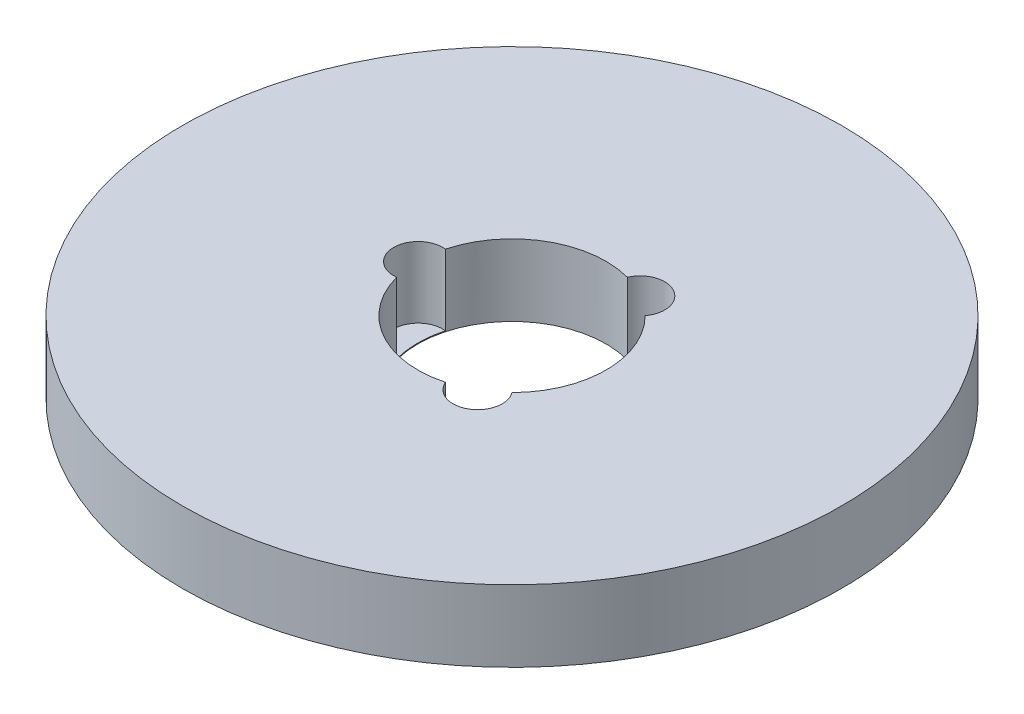
from build123d import *

# Parameters (mm, degrees)
SKETCH1_R           = 87.5
BOSS_EXTRUDE1_DEPTH = 19
SKETCH2_R           = 25
CUT_EXTRUDE1_DEPTH  = 126.193849689
SKETCH3_R           = 6.512696836
CUT_EXTRUDE2_DEPTH  = 18.77068866
CIRPATTERN1_COUNT   = 3


with BuildPart() as part:
    # Sketch1 → Boss-Extrude1 (new body)
    with BuildSketch(Plane(origin=(0, 0, 0), x_dir=(1, 0, 0), z_dir=(0, 1, 0))):
        Circle(SKETCH1_R)
    extrude(amount=BOSS_EXTRUDE1_DEPTH)

    # Sketch2 → Cut-Extrude1 (cut, through all)
    with BuildSketch(Plane(origin=(0, 0, 0), x_dir=(1, 0, 0), z_dir=(0, 1, 0))):
        Circle(SKETCH2_R)
    extrude(amount=CUT_EXTRUDE1_DEPTH, mode=Mode.SUBTRACT)

    # Sketch3 → Cut-Extrude2 (cut)
    with BuildSketch(Plane(origin=(0, 19, 0), x_dir=(1, 0, 0), z_dir=(0, 1, 0))):
        with Locations((-24.910626138, 0)):
            Circle(SKETCH3_R)
    cut_extrude2 = extrude(amount=-CUT_EXTRUDE2_DEPTH, mode=Mode.SUBTRACT)

    # CirPattern1: Cut-Extrude2 ×3 about axis
    cirpattern1_axis = Axis((0, 0, 0), (0, 1, 0))
    for i in range(1, CIRPATTERN1_COUNT):
        add(cut_extrude2.rotate(cirpattern1_axis, i * 360 / CIRPATTERN1_COUNT), mode=Mode.SUBTRACT)


solid = part.part
